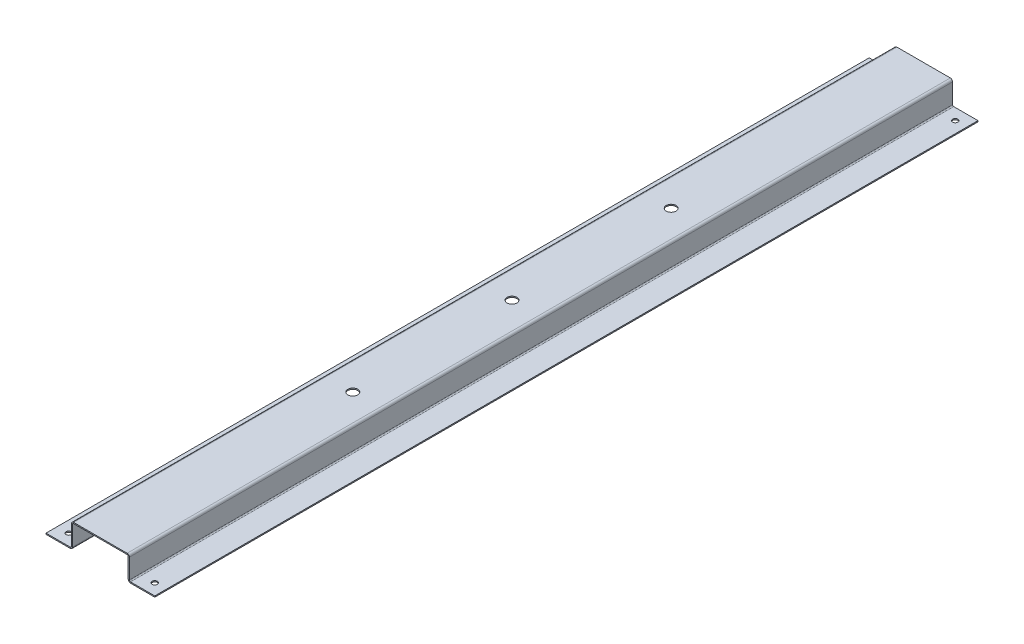
from build123d import *

# Parameters (mm, degrees)
SM_BASE_FLANGE_1_DEPTH = 543
SKETCH_7_R             = 3.5
CUT_EXTRUDE_2_DEPTH    = 10
SKETCH_8_R             = 6.5
CUT_EXTRUDE_3_DEPTH    = 10


# Sheet-metal steps are written as plain solids
with BuildPart() as part:
    # Sketch 1 → Базовая кромка1 (new, symmetric)
    with BuildSketch(Plane.XY):
        with BuildLine():
            Line((-71.75, -30.5), (-39.75, -30.5))
            ThreePointArc((-39.75, -30.5), (-37.628679656, -29.621320344), (-36.75, -27.5))
            Line((-36.75, -27.5), (-36.75, -1.5))
            ThreePointArc((-36.75, -1.5), (-36.310660172, -0.439339828), (-35.25, 0))
            Line((-35.25, 0), (35.25, 0))
            ThreePointArc((35.25, 0), (36.310660172, -0.439339828), (36.75, -1.5))
            Line((36.75, -1.5), (36.75, -27.5))
            ThreePointArc((36.75, -27.5), (37.628679656, -29.621320344), (39.75, -30.5))
            Line((39.75, -30.5), (71.75, -30.5))
            Line((71.75, -30.5), (71.75, -29))
            Line((71.75, -29), (39.75, -29))
            ThreePointArc((39.75, -29), (38.689339828, -28.560660172), (38.25, -27.5))
            Line((38.25, -27.5), (38.25, -1.5))
            ThreePointArc((38.25, -1.5), (37.371320344, 0.621320344), (35.25, 1.5))
            Line((35.25, 1.5), (-35.25, 1.5))
            ThreePointArc((-35.25, 1.5), (-37.371320344, 0.621320344), (-38.25, -1.5))
            Line((-38.25, -1.5), (-38.25, -27.5))
            ThreePointArc((-38.25, -27.5), (-38.689339828, -28.560660172), (-39.75, -29))
            Line((-39.75, -29), (-71.75, -29))
            Line((-71.75, -29), (-71.75, -30.5))
        make_face()
    extrude(amount=SM_BASE_FLANGE_1_DEPTH, both=True)

    # Эскиз7 → Вырез-Вытянуть2 (cut)
    with BuildSketch(Plane.XZ.offset(30.5)):
        with Locations((56.75, 528)):
            Circle(SKETCH_7_R)
        with Locations((-56.75, 528)):
            Circle(SKETCH_7_R)
        with Locations((56.75, -528)):
            Circle(SKETCH_7_R)
        with Locations((-56.75, -528)):
            Circle(SKETCH_7_R)
    extrude(amount=-CUT_EXTRUDE_2_DEPTH, mode=Mode.SUBTRACT)

    # Эскиз8 → Вырез-Вытянуть3 (cut)
    with BuildSketch(Plane(origin=(0, 1.5, 0), x_dir=(1, 0, 0), z_dir=(0, 1, 0))):
        with Locations(Location((0, 210, 0), (0, 0, 270))):
            Circle(SKETCH_8_R)
        with Locations(Location((0, 0, 0), (0, 0, 270))):
            Circle(SKETCH_8_R)
        with Locations(Location((0, -210, 0), (0, 0, 270))):
            Circle(SKETCH_8_R)
    extrude(amount=-CUT_EXTRUDE_3_DEPTH, mode=Mode.SUBTRACT)


solid = part.part
